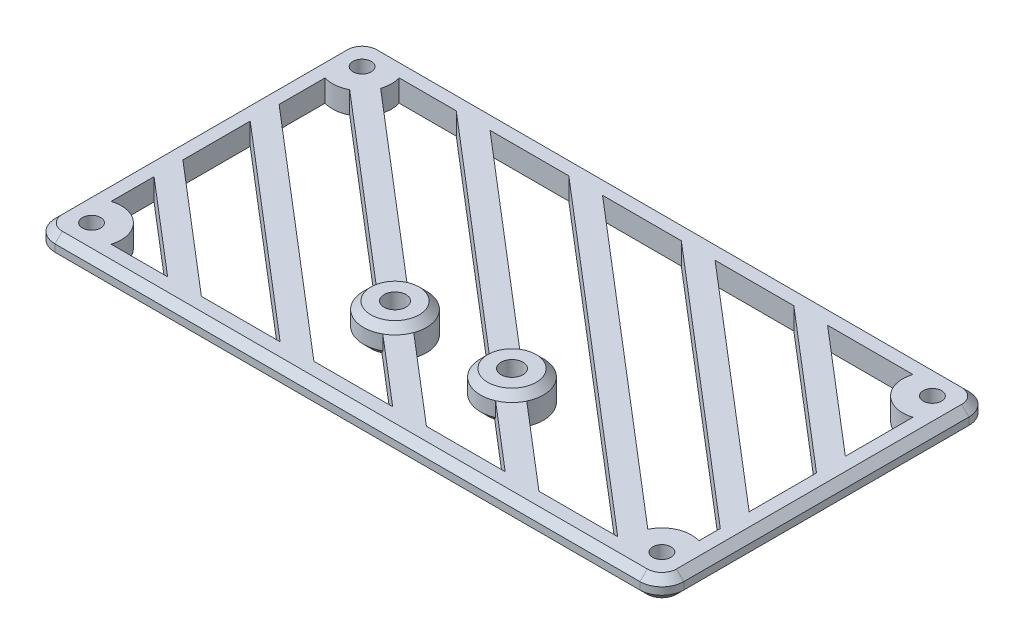
from build123d import *
from build123d.topology import SkipClean

# Parameters (mm, degrees)
SKETCH1_W           = 86
SKETCH1_H           = 45
SKETCH1_R           = 1.25
BOSS_EXTRUDE1_DEPTH = 3
FILLET1_R           = 3
SKETCH2_R           = 1.5
CUT_EXTRUDE1_DEPTH  = 49.623553963
SHELL1_T            = -2.8
RIB1_REACH          = 50.624
CUT_EXTRUDE2_DEPTH  = 49.623553963
BOSS_EXTRUDE2_START = 1
SKETCH5_R           = 4.3
SKETCH5_R_2         = 1.5
BOSS_EXTRUDE2_DEPTH = 1
CHAMFER1_SIZE       = 1


with BuildPart() as part:
    # Sketch1 → Boss-Extrude1 (new body)
    with BuildSketch(Plane(origin=(0, 0, 0), x_dir=(1, 0, 0), z_dir=(0, 1, 0))):
        Rectangle(SKETCH1_W, SKETCH1_H)
        with Locations(Location((-39, 18.5, 0), (0, 0, 270))):
            Circle(SKETCH1_R, mode=Mode.SUBTRACT)
        with Locations(Location((39, 18.5, 0), (0, 0, 270))):
            Circle(SKETCH1_R, mode=Mode.SUBTRACT)
        with Locations(Location((39, -18.5, 0), (0, 0, 270))):
            Circle(SKETCH1_R, mode=Mode.SUBTRACT)
        with Locations(Location((-39, -18.5, 0), (0, 0, 270))):
            Circle(SKETCH1_R, mode=Mode.SUBTRACT)
    extrude(amount=BOSS_EXTRUDE1_DEPTH)

    # Fillet1
    fillet1_edges = [part.edges().sort_by_distance(p)[0] for p in [
        (43, 1.5, 22.5),
        (-43, 1.5, 22.5),
        (-43, 1.5, -22.5),
        (43, 1.5, -22.5),
    ]]
    fillet(fillet1_edges, radius=FILLET1_R)

    # Sketch2 → Cut-Extrude1 (cut, through all)
    with BuildSketch(Plane(origin=(0, 3, 0), x_dir=(1, 0, 0), z_dir=(0, 1, 0))):
        with Locations(Location((8, -8, 0), (0, 0, 270))):
            Circle(SKETCH2_R)
        with Locations(Location((-8, -8, 0), (0, 0, 270))):
            Circle(SKETCH2_R)
    extrude(amount=-CUT_EXTRUDE1_DEPTH, mode=Mode.SUBTRACT)

    # Shell1
    shell1_openings = [part.faces().sort_by_distance(p)[0] for p in [
        (0, 3, -0.029540883),
    ]]
    offset(amount=SHELL1_T, openings=shell1_openings)

    # Sketch3 walls → Rib1 (add, up to next)
    with BuildSketch(Plane(origin=(0, 3, 0), x_dir=(1, 0, 0), z_dir=(0, 1, 0)), mode=Mode.PRIVATE) as rib1_sk1:
        Polygon((-77.783977456, 23.369087639), (9.570170192, -51.304619221), (11.519513639, -49.024255188), (-75.834634008, 25.649451672), align=None)
    rib1_tool1 = extrude(rib1_sk1.sketch, amount=-RIB1_REACH, mode=Mode.PRIVATE) - part.part
    # Sketch3 walls → Rib1 (add, up to next)
    with BuildSketch(Plane(origin=(0, 3, 0), x_dir=(1, 0, 0), z_dir=(0, 1, 0)), mode=Mode.PRIVATE) as rib1_sk2:
        Polygon((-75.930079406, 34.940098058), (22.974178135, -49.60708984), (24.923521582, -47.326725807), (-73.980735959, 37.220462091), align=None)
    rib1_tool2 = extrude(rib1_sk2.sketch, amount=-RIB1_REACH, mode=Mode.PRIVATE) - part.part
    # Sketch3 walls → Rib1 (add, up to next)
    with BuildSketch(Plane(origin=(0, 3, 0), x_dir=(1, 0, 0), z_dir=(0, 1, 0)), mode=Mode.PRIVATE) as rib1_sk3:
        Polygon((26.191376207, -35.254742784), (-71.50019667, 48.255795321), (-73.449540118, 45.975431288), (24.24203276, -37.535106817), align=None)
    rib1_tool3 = extrude(rib1_sk3.sketch, amount=-RIB1_REACH, mode=Mode.PRIVATE) - part.part
    # Sketch3 walls → Rib1 (add, up to next)
    with BuildSketch(Plane(origin=(0, 3, 0), x_dir=(1, 0, 0), z_dir=(0, 1, 0)), mode=Mode.PRIVATE) as rib1_sk4:
        Polygon((41.943939257, -35.56484922), (-56.370030956, 48.47773822), (-58.319374403, 46.197374186), (39.994595809, -37.845213253), align=None)
    rib1_tool4 = extrude(rib1_sk4.sketch, amount=-RIB1_REACH, mode=Mode.PRIVATE) - part.part
    # Sketch3 walls → Rib1 (add, up to next)
    with BuildSketch(Plane(origin=(0, 3, 0), x_dir=(1, 0, 0), z_dir=(0, 1, 0)), mode=Mode.PRIVATE) as rib1_sk5:
        Polygon((-42.364199116, 19.402478496), (40.17566685, -51.155794023), (42.125010297, -48.87542999), (-40.414855668, 21.682842529), align=None)
    rib1_tool5 = extrude(rib1_sk5.sketch, amount=-RIB1_REACH, mode=Mode.PRIVATE) - part.part
    # Sketch3 walls → Rib1 (add, up to next)
    with BuildSketch(Plane(origin=(0, 3, 0), x_dir=(1, 0, 0), z_dir=(0, 1, 0)), mode=Mode.PRIVATE) as rib1_sk6:
        Polygon((-27.344787823, 19.719098562), (56.5220764, -51.973543436), (58.471419848, -49.693179403), (-25.395444376, 21.999462595), align=None)
    rib1_tool6 = extrude(rib1_sk6.sketch, amount=-RIB1_REACH, mode=Mode.PRIVATE) - part.part
    # Sketch3 walls → Rib1 (add, up to next)
    with BuildSketch(Plane(origin=(0, 3, 0), x_dir=(1, 0, 0), z_dir=(0, 1, 0)), mode=Mode.PRIVATE) as rib1_sk7:
        Polygon((-44.38155309, 47.438579234), (68.87285442, -49.375672346), (70.822197867, -47.095308313), (-42.432209642, 49.718943267), align=None)
    rib1_tool7 = extrude(rib1_sk7.sketch, amount=-RIB1_REACH, mode=Mode.PRIVATE) - part.part
    # Sketch3 walls → Rib1 (add, up to next)
    with BuildSketch(Plane(origin=(0, 3, 0), x_dir=(1, 0, 0), z_dir=(0, 1, 0)), mode=Mode.PRIVATE) as rib1_sk8:
        Polygon((-28.60953629, 47.11184298), (71.48616066, -38.453833446), (73.435504108, -36.173469413), (-26.660192843, 49.392207013), align=None)
    rib1_tool8 = extrude(rib1_sk8.sketch, amount=-RIB1_REACH, mode=Mode.PRIVATE) - part.part
    # Sketch3 walls → Rib1 (add, up to next)
    with BuildSketch(Plane(origin=(0, 3, 0), x_dir=(1, 0, 0), z_dir=(0, 1, 0)), mode=Mode.PRIVATE) as rib1_sk9:
        Polygon((-14.02835821, 47.803081759), (73.331762126, -26.875730786), (75.281105573, -24.595366753), (-12.079014763, 50.083445792), align=None)
    rib1_tool9 = extrude(rib1_sk9.sketch, amount=-RIB1_REACH, mode=Mode.PRIVATE) - part.part
    add(rib1_tool1.solids().sort_by_distance((-33.132231908, 3, 12.827583774))[0])
    add(rib1_tool2.solids().sort_by_distance((-25.503278912, 3, 6.193313875))[0])
    add(rib1_tool3.solids().sort_by_distance((-23.629081955, 3, -5.360344252))[0])
    add(rib1_tool4.solids().sort_by_distance((-8.187717573, 3, -5.316262483))[0])
    add(rib1_tool5.solids().sort_by_distance((-0.119594409, 3, 14.736475747))[0])
    add(rib1_tool6.solids().sort_by_distance((15.563316012, 3, 14.987040421))[0])
    add(rib1_tool7.solids().sort_by_distance((13.220322389, 3, -0.17163546))[0])
    add(rib1_tool8.solids().sort_by_distance((22.412983909, 3, -5.469186783))[0])
    add(rib1_tool9.solids().sort_by_distance((30.626373682, 3, -11.603857503))[0])

    # Sketch4 → Cut-Extrude2 (cut, through all)
    with SkipClean():  # the faces are left unmerged after this step: merging them gives an invalid solid
        with BuildSketch(Plane(origin=(0, 3, 0), x_dir=(1, 0, 0), z_dir=(0, 1, 0))):
            with BuildLine():
                Line((-27.401271161, -19.7), (-40.2, -8.759151154))
                Line((-40.2, -8.759151154), (-40.2, -14.631860913))
                ThreePointArc((-40.2, -14.631860913), (-36.136217536, -15.636217536), (-35.131860913, -19.7))
                Line((-35.131860913, -19.7), (-27.401271161, -19.7))
            make_face()
            Polygon((-12.011474131, -19.7), (-40.2, 4.396643081), (-40.2, -4.812412883), (-22.784332052, -19.7), align=None)
            with BuildLine():
                Line((3.378322898, -19.7), (-5.911467584, -11.758727491))
                ThreePointArc((-5.911467584, -11.758727491), (-10.794058942, -11.268521781), (-12.037875863, -6.521636542))
                Line((-12.037875863, -6.521636542), (-37.115109774, 14.915353736))
                ThreePointArc((-37.115109774, 14.915353736), (-38.629377954, 14.466993764), (-40.2, 14.631860913))
                Line((-40.2, 14.631860913), (-40.2, 8.343381352))
                Line((-40.2, 8.343381352), (-7.394535022, -19.7))
                Line((-7.394535022, -19.7), (3.378322898, -19.7))
            make_face()
            with BuildLine():
                Line((18.768119928, -19.7), (9.701138512, -11.949193305))
                ThreePointArc((9.701138512, -11.949193305), (5.205941058, -11.268521781), (3.834243685, -6.933944502))
                Line((3.834243685, -6.933944502), (-27.32244611, 19.7))
                Line((-27.32244611, 19.7), (-35.131860913, 19.7))
                ThreePointArc((-35.131860913, 19.7), (-34.950371139, 18.445172177), (-35.165766327, 17.195717769))
                Line((-35.165766327, 17.195717769), (-10.088532416, -4.241272509))
                ThreePointArc((-10.088532416, -4.241272509), (-5.205941058, -4.731478219), (-3.962124137, -9.478363458))
                Line((-3.962124137, -9.478363458), (7.995262007, -19.7))
                Line((7.995262007, -19.7), (18.768119928, -19.7))
            make_face()
            with BuildLine():
                Line((34.157916958, -19.7), (-11.93264908, 19.7))
                Line((-11.93264908, 19.7), (-22.705507001, 19.7))
                Line((-22.705507001, 19.7), (5.557974977, -4.460718465))
                ThreePointArc((5.557974977, -4.460718465), (10.794058942, -4.731478219), (11.876094115, -9.861691277))
                Line((11.876094115, -9.861691277), (23.385059037, -19.7))
                Line((23.385059037, -19.7), (34.157916958, -19.7))
            make_face()
            with BuildLine():
                Line((40.2, -11.709212236), (3.45714795, 19.7))
                Line((3.45714795, 19.7), (-7.315709971, 19.7))
                Line((-7.315709971, 19.7), (35.340744315, -16.764388341))
                ThreePointArc((35.340744315, -16.764388341), (37.372454935, -14.791415761), (40.2, -14.631860913))
                Line((40.2, -14.631860913), (40.2, -11.709212236))
            make_face()
            Polygon((40.2, 1.446581999), (18.84694498, 19.7), (8.074087059, 19.7), (40.2, -7.762473966), align=None)
            with BuildLine():
                Line((35.131860913, 19.7), (23.463884089, 19.7))
                Line((23.463884089, 19.7), (40.2, 5.393320269))
                Line((40.2, 5.393320269), (40.2, 14.631860913))
                ThreePointArc((40.2, 14.631860913), (36.136217536, 15.636217536), (35.131860913, 19.7))
            make_face()
        extrude(amount=-CUT_EXTRUDE2_DEPTH, mode=Mode.SUBTRACT)

    # Sketch5 → Boss-Extrude2 (add)
    # profile 1 of 2: a face of its own
    with SkipClean():  # the faces are left unmerged after this step: merging them gives an invalid solid
        with BuildSketch(Plane(origin=(0, 3, 0), x_dir=(1, 0, 0), z_dir=(0, 1, 0)).offset(BOSS_EXTRUDE2_START)):
            with Locations(Location((-8, -8, 0), (0, 0, 270))):
                Circle(SKETCH5_R)
            with Locations(Location((-8, -8, 0), (0, 0, 270))):
                Circle(SKETCH5_R_2, mode=Mode.SUBTRACT)
        # profile 2 of 2: a face of its own
        with BuildSketch(Plane(origin=(0, 3, 0), x_dir=(1, 0, 0), z_dir=(0, 1, 0)).offset(BOSS_EXTRUDE2_START)):
            with Locations(Location((8, -8, 0), (0, 0, 270))):
                Circle(SKETCH5_R)
            with Locations(Location((8, -8, 0), (0, 0, 270))):
                Circle(SKETCH5_R_2, mode=Mode.SUBTRACT)
        extrude(amount=-BOSS_EXTRUDE2_DEPTH)

    # Chamfer1
    chamfer1_edges = [part.edges().sort_by_distance(p)[0] for p in [
        (-8, 4, 3.7),
        (8, 4, 3.7),
        (-43, 0, 0),
        (-43, 3, 0),
        (43, 0, 0),
        (0, 0, 22.5),
        (0, 0, -22.5),
        (-42.121320344, 0, 21.621320344),
        (42.121320344, 0, 21.621320344),
        (42.121320344, 0, -21.621320344),
        (-42.121320344, 0, -21.621320344),
        (0, 3, -22.5),
        (43, 3, 0),
        (0, 3, 22.5),
        (-42.121320344, 3, 21.621320344),
        (42.121320344, 3, 21.621320344),
        (42.121320344, 3, -21.621320344),
        (-42.121320344, 3, -21.621320344),
        (5.205941058, 0, 11.268521781),
        (-10.794058942, 0, 11.268521781),
    ]]
    chamfer(chamfer1_edges, length=CHAMFER1_SIZE - 0.0001)  # a hair under: the kernel refuses the full size


solid = part.part
